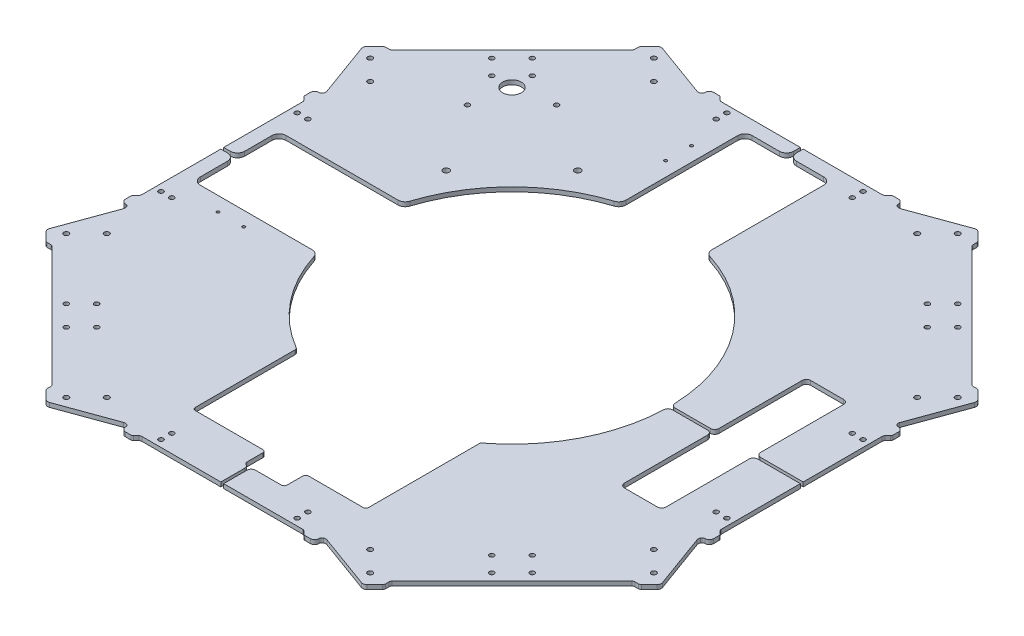
from build123d import *

# Parameters (mm, degrees)
SKETCH_1_R                 = 110
EXTRUDE_1_DEPTH            = 3
SKETCH_2_W                 = 110
SKETCH_2_H                 = 98
CUT_EXTRUDE_1_DEPTH        = 10
SKETCH_3_W                 = 11
SKETCH_3_H                 = 90
CUT_EXTRUDE_2_DEPTH        = 10
SKETCH_4_W                 = 28
SKETCH_4_H                 = 30
CUT_EXTRUDE_3_DEPTH        = 10
FILLET_1_R                 = 2
SKETCH_5_R                 = 2.65
SKETCH_5_R_2               = 1.65
CUT_EXTRUDE_4_DEPTH        = 10
SKETCH_6_W                 = 135
SKETCH_6_H                 = 32
SKETCH_6_W_2               = 32
SKETCH_6_H_2               = 135
CUT_EXTRUDE_5_DEPTH        = 313.909132177
SKETCH_7_W                 = 29
SKETCH_7_H                 = 130
CUT_EXTRUDE_6_DEPTH        = 10
EXTRUDE_2_DEPTH            = 3
SKETCH_12_R                = 1.65
CUT_EXTRUDE_7_DEPTH        = 112
CUT_EXTRUDE_1_2_DEPTH      = 304.514826656
CUT_EXTRUDE_1_2_DEPTH_BACK = 304.514826656
SKETCH_13_W                = 410.5
SKETCH_13_H                = 2
CUT_EXTRUDE_2_2_DEPTH      = 304.514826656
CUT_EXTRUDE_2_2_DEPTH_BACK = 304.514826656
SKETCH_14_W                = 2
SKETCH_14_H                = 410.5
FILLET_2_R                 = 3
FILLET_3_R                 = 3
FILLET_4_R                 = 3
FILLET_5_R                 = 3
FILLET_6_R                 = 3
SKETCH_15_R                = 1.75
CUT_EXTRUDE_8_DEPTH        = 10
SKETCH_16_R                = 1.65
SKETCH_16_R_2              = 2.15
CUT_EXTRUDE_9_DEPTH        = 10
SKETCH_17_R                = 6.5
CUT_EXTRUDE_10_DEPTH       = 303.846289435
SKETCH_18_R                = 1
SKETCH_18_W                = 60
SKETCH_18_H                = 90
CUT_EXTRUDE_11_DEPTH       = 303.846289435
SKETCH_20_R                = 1
SKETCH_20_W                = 90
SKETCH_20_H                = 60
CUT_EXTRUDE_13_DEPTH       = 303.846289435
FILLET_7_R                 = 5
FILLET_8_R                 = 5
FILLET_9_R                 = 5
CUT_EXTRUDE_15_DEPTH       = 10
FILLET_12_R                = 2
FILLET_13_R                = 2
FILLET_14_R                = 2
FILLET_15_R                = 2
CUT_EXTRUDE_17_DEPTH       = 10
FILLET_16_R                = 2
FILLET_17_R                = 2
FILLET_18_R                = 2
FILLET_19_R                = 2


# Some blends are built 0.0001 mm under size
with BuildPart() as part:
    # 草图1 → 凸台-拉伸1 (new body)
    with BuildSketch(Plane(origin=(0, 0, 0), x_dir=(1, 0, 0), z_dir=(0, 1, 0))):
        Polygon((221.25, -67.5), (221.25, 67.5), (201.200576851, 67.5), (67.5, 201.200576851), (67.5, 221.25), (-67.5, 221.25), (-67.5, 201.200576851), (-201.200576851, 67.5), (-221.25, 67.5), (-221.25, -67.5), (-201.200576851, -67.5), (-67.5, -201.200576851), (-67.5, -221.25), (67.5, -221.25), (67.5, -201.200576851), (201.200576851, -67.5), align=None)
        with Locations(Location((0, 0, 0), (0, 0, 270))):
            Circle(SKETCH_1_R, mode=Mode.SUBTRACT)
    extrude(amount=EXTRUDE_1_DEPTH)

    # 草图2 → Cut-Extrude 1 (cut)
    with BuildSketch(Plane(origin=(0, 3, 0), x_dir=(1, 0, 0), z_dir=(0, 1, 0))):
        with Locations((0, -119)):
            Rectangle(SKETCH_2_W, SKETCH_2_H)
    extrude(amount=-CUT_EXTRUDE_1_DEPTH, mode=Mode.SUBTRACT)

    # 草图3 → Cut-Extrude 2 (cut)
    with BuildSketch(Plane(origin=(0, 3, 0), x_dir=(1, 0, 0), z_dir=(0, 1, 0))):
        with Locations((60.5, -123)):
            Rectangle(SKETCH_3_W, SKETCH_3_H)
    extrude(amount=-CUT_EXTRUDE_2_DEPTH, mode=Mode.SUBTRACT)

    # 草图4 → 切除-拉伸3 (cut)
    with BuildSketch(Plane(origin=(0, 3, 0), x_dir=(1, 0, 0), z_dir=(0, 1, 0))):
        with Locations((10, -168)):
            Rectangle(SKETCH_4_W, SKETCH_4_H)
    extrude(amount=-CUT_EXTRUDE_3_DEPTH, mode=Mode.SUBTRACT)

    # 圆角1
    fillet_1_edges = [part.edges().sort_by_distance(p)[0] for p in [
        (-4, 1.5, 183),
        (221.25, 1.5, -67.5),
        (221.25, 1.5, 67.5),
        (201.200576851, 1.5, 67.5),
        (67.5, 1.5, 201.200576851),
        (67.5, 1.5, 221.25),
        (-67.5, 1.5, 221.25),
        (-67.5, 1.5, 201.200576851),
        (-201.200576851, 1.5, 67.5),
        (-221.25, 1.5, 67.5),
        (-221.25, 1.5, -67.5),
        (-201.200576851, 1.5, -67.5),
        (-67.5, 1.5, -201.200576851),
        (-67.5, 1.5, -221.25),
        (67.5, 1.5, -221.25),
        (67.5, 1.5, -201.200576851),
        (201.200576851, 1.5, -67.5),
        (-55, 1.5, 95.262794416),
        (-55, 1.5, 168),
        (66, 1.5, 88),
        (66, 1.5, 168),
        (-4, 1.5, 168),
        (24, 1.5, 168),
        (24, 1.5, 183),
    ]]
    fillet(fillet_1_edges, radius=FILLET_1_R)

    # 草图5 → 切除-拉伸4 (cut)
    with BuildSketch(Plane(origin=(0, 3, 0), x_dir=(1, 0, 0), z_dir=(0, 1, 0))):
        with Locations(Location((-208.25, 47.5, 0), (0, 0, 270))):
            Circle(SKETCH_5_R)
        with Locations(Location((-197.5, 47.5, 0), (0, 0, 270))):
            Circle(SKETCH_5_R_2)
        with Locations(Location((-190, 47.5, 0), (0, 0, 270))):
            Circle(SKETCH_5_R_2)
        with Locations(Location((-190, -47.5, 0), (0, 0, 270))):
            Circle(SKETCH_5_R_2)
        with Locations(Location((-197.5, -47.5, 0), (0, 0, 270))):
            Circle(SKETCH_5_R_2)
        with Locations(Location((-208.25, -47.5, 0), (0, 0, 270))):
            Circle(SKETCH_5_R)
        with Locations(Location((47.5, 190, 0), (0, 0, 270))):
            Circle(SKETCH_5_R_2)
        with Locations(Location((47.5, 197.5, 0), (0, 0, 270))):
            Circle(SKETCH_5_R_2)
        with Locations(Location((47.5, 208.25, 0), (0, 0, 270))):
            Circle(SKETCH_5_R)
        with Locations(Location((-47.5, 208.25, 0), (0, 0, 270))):
            Circle(SKETCH_5_R)
        with Locations(Location((-47.5, 197.5, 0), (0, 0, 270))):
            Circle(SKETCH_5_R_2)
        with Locations(Location((-47.5, 190, 0), (0, 0, 270))):
            Circle(SKETCH_5_R_2)
        with Locations(Location((190, -47.5, 0), (0, 0, 270))):
            Circle(SKETCH_5_R_2)
        with Locations(Location((197.5, -47.5, 0), (0, 0, 270))):
            Circle(SKETCH_5_R_2)
        with Locations(Location((208.25, -47.5, 0), (0, 0, 270))):
            Circle(SKETCH_5_R)
        with Locations(Location((208.25, 47.5, 0), (0, 0, 270))):
            Circle(SKETCH_5_R)
        with Locations(Location((197.5, 47.5, 0), (0, 0, 270))):
            Circle(SKETCH_5_R_2)
        with Locations(Location((190, 47.5, 0), (0, 0, 270))):
            Circle(SKETCH_5_R_2)
        with Locations(Location((-47.5, -190, 0), (0, 0, 270))):
            Circle(SKETCH_5_R_2)
        with Locations(Location((-47.5, -197.5, 0), (0, 0, 270))):
            Circle(SKETCH_5_R_2)
        with Locations(Location((-47.5, -208.25, 0), (0, 0, 270))):
            Circle(SKETCH_5_R)
        with Locations(Location((47.5, -208.25, 0), (0, 0, 270))):
            Circle(SKETCH_5_R)
        with Locations(Location((47.5, -197.5, 0), (0, 0, 270))):
            Circle(SKETCH_5_R_2)
        with Locations(Location((47.5, -190, 0), (0, 0, 270))):
            Circle(SKETCH_5_R_2)
    extrude(amount=-CUT_EXTRUDE_4_DEPTH, mode=Mode.SUBTRACT)

    # 草图6 → 切除-拉伸5 (cut, through all)
    with BuildSketch(Plane(origin=(0, 3, 0), x_dir=(1, 0, 0), z_dir=(0, 1, 0))):
        with Locations((0, -221.25)):
            Rectangle(SKETCH_6_W, SKETCH_6_H)
        with Locations((-221.25, 0)):
            Rectangle(SKETCH_6_W_2, SKETCH_6_H_2)
        with Locations((221.25, 0)):
            Rectangle(SKETCH_6_W_2, SKETCH_6_H_2)
        with Locations((0, 221.25)):
            Rectangle(SKETCH_6_W, SKETCH_6_H)
    extrude(amount=-CUT_EXTRUDE_5_DEPTH, mode=Mode.SUBTRACT)

    # 草图7 → 切除-拉伸6 (cut)
    with BuildSketch(Plane(origin=(0, 3, 0), x_dir=(1, 0, 0), z_dir=(0, 1, 0))):
        with Locations((155, 0)):
            Rectangle(SKETCH_7_W, SKETCH_7_H)
    extrude(amount=-CUT_EXTRUDE_6_DEPTH, mode=Mode.SUBTRACT)

    # 草图8 → 凸台-拉伸2 (add)
    with BuildSketch(Plane(origin=(0, 3, 0), x_dir=(1, 0, 0), z_dir=(0, 1, 0))):
        Polygon((110.662211256, -214.60690809), (214.60690809, -110.662211256), (199.511809131, -69.18876772), (69.18876772, -199.511809131), align=None)
        Polygon((214.60690809, 110.662211256), (199.511809131, 69.18876772), (69.18876772, 199.511809131), (110.662211256, 214.60690809), align=None)
        Polygon((-214.60690809, -110.662211256), (-199.511809131, -69.18876772), (-69.18876772, -199.511809131), (-110.662211256, -214.60690809), align=None)
        Polygon((-110.662211256, 214.60690809), (-214.60690809, 110.662211256), (-199.511809131, 69.18876772), (-69.18876772, 199.511809131), align=None)
    extrude(amount=-EXTRUDE_2_DEPTH)

    # 草图12 → 切除-拉伸7 (cut)
    with BuildSketch(Plane(origin=(0, 3, 0), x_dir=(1, 0, 0), z_dir=(0, 1, 0))):
        with Locations(Location((162.634559673, -148.492424049, 0), (0, 0, 270))):
            Circle(SKETCH_12_R)
        with Locations(Location((152.027957955, -137.885822331, 0), (0, 0, 270))):
            Circle(SKETCH_12_R)
        with Locations(Location((137.885822331, -152.027957955, 0), (0, 0, 270))):
            Circle(SKETCH_12_R)
        with Locations(Location((148.492424049, -162.634559673, 0), (0, 0, 270))):
            Circle(SKETCH_12_R)
        with Locations(Location((148.492424049, 162.634559673, 0), (0, 0, 270))):
            Circle(SKETCH_12_R)
        with Locations(Location((137.885822331, 152.027957955, 0), (0, 0, 270))):
            Circle(SKETCH_12_R)
        with Locations(Location((152.027957955, 137.885822331, 0), (0, 0, 270))):
            Circle(SKETCH_12_R)
        with Locations(Location((162.634559673, 148.492424049, 0), (0, 0, 270))):
            Circle(SKETCH_12_R)
        with Locations(Location((-148.492424049, -162.634559673, 0), (0, 0, 270))):
            Circle(SKETCH_12_R)
        with Locations(Location((-137.885822331, -152.027957955, 0), (0, 0, 270))):
            Circle(SKETCH_12_R)
        with Locations(Location((-152.027957955, -137.885822331, 0), (0, 0, 270))):
            Circle(SKETCH_12_R)
        with Locations(Location((-162.634559673, -148.492424049, 0), (0, 0, 270))):
            Circle(SKETCH_12_R)
        with Locations(Location((-162.634559673, 148.492424049, 0), (0, 0, 270))):
            Circle(SKETCH_12_R)
        with Locations(Location((-152.027957955, 137.885822331, 0), (0, 0, 270))):
            Circle(SKETCH_12_R)
        with Locations(Location((-137.885822331, 152.027957955, 0), (0, 0, 270))):
            Circle(SKETCH_12_R)
        with Locations(Location((-148.492424049, 162.634559673, 0), (0, 0, 270))):
            Circle(SKETCH_12_R)
    extrude(amount=-CUT_EXTRUDE_7_DEPTH, mode=Mode.SUBTRACT)

    # 草图13 → Cut-Extrude 1 2 (cut, two sides: drawn at the far end of the back side and taken through both)
    with BuildSketch(Plane(origin=(0, 3, 0), x_dir=(1, 0, 0), z_dir=(0, 1, 0)).offset(-CUT_EXTRUDE_1_2_DEPTH_BACK)):
        Rectangle(SKETCH_13_W, SKETCH_13_H)
    extrude(amount=CUT_EXTRUDE_1_2_DEPTH + CUT_EXTRUDE_1_2_DEPTH_BACK, mode=Mode.SUBTRACT)


with BuildPart() as cut_extrude_1_2_piece_1:
    # of the separate pieces the step leaves, piece 1, a body of its own (cut_extrude_1_2_pieces)
    add(part.part.solids().sort_by_distance((169.5, 0, -1))[0])


with BuildPart() as cut_extrude_1_2_piece_2:
    # of the separate pieces the step leaves, piece 2, a body of its own (cut_extrude_1_2_pieces)
    add(part.part.solids().sort_by_distance((202.029003976, 0, 67.5))[0])


with BuildPart() as cut_extrude_2_2_tool:
    # 草图14 → Cut-Extrude 2 2 (new, two sides: drawn at the far end of the back side and taken through both)
    with BuildSketch(Plane(origin=(0, 3, 0), x_dir=(1, 0, 0), z_dir=(0, 1, 0)).offset(-CUT_EXTRUDE_2_2_DEPTH_BACK)):
        Rectangle(SKETCH_14_W, SKETCH_14_H)
    extrude(amount=CUT_EXTRUDE_2_2_DEPTH + CUT_EXTRUDE_2_2_DEPTH_BACK)


with BuildPart() as cut_extrude_1_2_piece_1_1:
    add(cut_extrude_1_2_piece_1.part)

    # Cut-Extrude 2 2: cut by cut_extrude_2_2_tool
    add(cut_extrude_2_2_tool.part, mode=Mode.SUBTRACT)


with BuildPart() as cut_extrude_1_2_piece_2_1:
    add(cut_extrude_1_2_piece_2.part)

    # Cut-Extrude 2 2: cut by cut_extrude_2_2_tool
    add(cut_extrude_2_2_tool.part, mode=Mode.SUBTRACT)


with BuildPart() as cut_extrude_2_2_piece_1:
    # of the separate pieces the step leaves, piece 1, a body of its own (cut_extrude_2_2_pieces)
    add(cut_extrude_1_2_piece_1_1.part.solids().sort_by_distance((-1, 0, -109.995454452))[0])

    # 圆角5
    # the kernel refuses this fillet: 3 mm, written as the material it adds along each edge
    with BuildSketch(Plane(origin=(-69.18876772, 3, -199.511809131), x_dir=(-0.9396926207859093, 0, -0.3420201433256662), z_dir=(0, -1, 0))) as fillet_5_piece_1:
        with BuildLine():
            CenterArc((1.887083369, 3), FILLET_5_R, 211.922044532, 58.077955468)
            Line((-0.659221556, 1.413705188), (0, 0))
            Line((0, 0), (1.887083369, 0))
        make_face()
    extrude(amount=3)
    with BuildSketch(Plane(origin=(-199.511809131, 3, -69.18876772), x_dir=(-0.7071067811865065, 0, 0.7071067811865885), z_dir=(0, -1, 0))) as fillet_5_piece_2:
        with BuildLine():
            CenterArc((1.921407468, 2.978133138), FILLET_5_R, 205, 58.077955468)
            Line((-0.797515893, 1.710278352), (0, 0))
            Line((0, 0), (1.559851089, 0))
        make_face()
    extrude(amount=3)
    # the kernel refuses this fillet: 3 mm, written as the material it takes off along each edge
    with BuildSketch(Plane(origin=(-67.5, 10.5, -205.25), x_dir=(0, 0, 1), z_dir=(0, -1, 0)), Plane(origin=(-205.25, 10.5, -67.5), x_dir=(0, 0, 1), z_dir=(0, -1, 0)), Plane(origin=(-205.25, 10.5, -1), x_dir=(1, 0, 0), z_dir=(0, -1, 0)), Plane(origin=(-1, 10.5, -205.25), x_dir=(-1, 0, 0), z_dir=(0, -1, 0))) as fillet_5_2_piece_1:
        with BuildLine():
            CenterArc((FILLET_5_R, -FILLET_5_R), FILLET_5_R, 90, 90)
            Line((0, -FILLET_5_R), (0, 0))
            Line((0, 0), (FILLET_5_R, 0))
        make_face()
    extrude(amount=18, mode=Mode.SUBTRACT)
    with BuildSketch(Plane(origin=(-110.662211256, 7.778026956, -214.60690809), x_dir=(-0.7071067811865476, 0, 0.7071067811865476), z_dir=(0, -1, 0)), Plane(origin=(-214.60690809, 7.778026956, -110.662211256), x_dir=(0.34202014332566893, 0, 0.9396926207859083), z_dir=(0, -1, 0))) as fillet_5_2_piece_2:
        with BuildLine():
            CenterArc((FILLET_5_R * 0.637070260807, -FILLET_5_R), FILLET_5_R, 90, 65)
            Line((-FILLET_5_R * 0.269237526229, -FILLET_5_R * 0.577381738259), (0, 0))
            Line((0, 0), (FILLET_5_R * 0.637070260807, 0))
        make_face()
    extrude(amount=12.556053912, mode=Mode.SUBTRACT)
    with BuildSketch(Plane(origin=(-109.995454452, 10.334317242, -1), x_dir=(0.022246495156751204, 0, -0.9997525161024806), z_dir=(0, -1, 0))) as fillet_5_2_piece_3:
        with BuildLine():
            CenterArc((2.933992407, -2.999740332), FILLET_5_R, 90.753857544, 87.971407014)
            Line((-0.065265141, -2.933000847), (0, 0))
            ThreePointArc((0, 0), (1.447260829, -0.009521157), (2.894521657, 0))
        make_face()
    extrude(amount=17.668634484, mode=Mode.SUBTRACT)
    with BuildSketch(Plane(origin=(-1, 10.334317242, -109.995454452), x_dir=(-0.9997525161024806, 0, 0.02224649515675109), z_dir=(0, -1, 0))) as fillet_5_2_piece_4:
        with BuildLine():
            CenterArc((2.933992407, 2.999740332), FILLET_5_R, 181.274735442, 87.971407014)
            Line((-0.065265141, 2.933000847), (0, 0))
            ThreePointArc((0, 0), (1.447260829, 0.009521157), (2.894521657, 0))
        make_face()
    extrude(amount=17.668634484, mode=Mode.SUBTRACT)


with BuildPart() as cut_extrude_2_2_piece_2:
    # of the separate pieces the step leaves, piece 2, a body of its own (cut_extrude_2_2_pieces)
    add(cut_extrude_1_2_piece_1_1.part.solids().sort_by_distance((169.5, 0, -65))[0])

    # 圆角4
    # the kernel refuses this fillet: 3 mm, written as the material it adds along each edge
    with BuildSketch(Plane(origin=(69.18876772, 3, -199.511809131), x_dir=(-0.7071067811865521, 0, -0.7071067811865429), z_dir=(0, -1, 0))) as fillet_4_piece_1:
        with BuildLine():
            CenterArc((1.921407468, 2.978133138), FILLET_4_R, 205, 58.077955468)
            Line((-0.797515893, 1.710278352), (0, 0))
            Line((0, 0), (1.559851089, 0))
        make_face()
    extrude(amount=3)
    with BuildSketch(Plane(origin=(169.5, 3, -65), x_dir=(0, 0, 1), z_dir=(0, -1, 0)), Plane(origin=(140.5, 3, -65), x_dir=(1, 0, 0), z_dir=(0, -1, 0))) as fillet_4_piece_2:
        with BuildLine():
            CenterArc((FILLET_4_R, FILLET_4_R), FILLET_4_R, 180, 90)
            Line((0, FILLET_4_R), (0, 0))
            Line((0, 0), (FILLET_4_R, 0))
        make_face()
    extrude(amount=3)
    # the kernel refuses this fillet: 3 mm, written as the material it takes off along each edge
    with BuildSketch(Plane(origin=(1, 10.334317242, -109.995454452), x_dir=(0.9997525161024806, 0, 0.022246495156751034), z_dir=(0, -1, 0))) as fillet_4_2_piece_1:
        with BuildLine():
            CenterArc((2.933992407, -2.999740332), FILLET_4_R, 90.753857544, 87.971407014)
            Line((-0.065265141, -2.933000847), (0, 0))
            ThreePointArc((0, 0), (1.447260829, -0.009521157), (2.894521657, 0))
        make_face()
    extrude(amount=17.668634484, mode=Mode.SUBTRACT)
    with BuildSketch(Plane(origin=(1, 10.5, -205.25), x_dir=(0, 0, 1), z_dir=(0, -1, 0)), Plane(origin=(67.5, 10.5, -205.25), x_dir=(-1, 0, 0), z_dir=(0, -1, 0)), Plane(origin=(205.25, 10.5, -67.5), x_dir=(-1, 0, 0), z_dir=(0, -1, 0)), Plane(origin=(140.5, 10.5, -1), x_dir=(0, 0, -1), z_dir=(0, -1, 0)), Plane(origin=(169.5, -7.5, -1), x_dir=(0, 0, -1), z_dir=(0, 1, 0))) as fillet_4_2_piece_2:
        with BuildLine():
            CenterArc((FILLET_4_R, -FILLET_4_R), FILLET_4_R, 90, 90)
            Line((0, -FILLET_4_R), (0, 0))
            Line((0, 0), (FILLET_4_R, 0))
        make_face()
    extrude(amount=18, mode=Mode.SUBTRACT)
    with BuildSketch(Plane(origin=(110.662211256, 7.778026956, -214.60690809), x_dir=(-0.9396926207859083, 0, 0.34202014332566893), z_dir=(0, -1, 0)), Plane(origin=(214.60690809, 7.778026956, -110.662211256), x_dir=(-0.7071067811865476, 0, -0.7071067811865476), z_dir=(0, -1, 0))) as fillet_4_2_piece_3:
        with BuildLine():
            CenterArc((FILLET_4_R * 0.637070260807, -FILLET_4_R), FILLET_4_R, 90, 65)
            Line((-FILLET_4_R * 0.269237526229, -FILLET_4_R * 0.577381738259), (0, 0))
            Line((0, 0), (FILLET_4_R * 0.637070260808, 0))
        make_face()
    extrude(amount=12.556053912, mode=Mode.SUBTRACT)
    with BuildSketch(Plane(origin=(109.995454452, 10.334317242, -1), x_dir=(1, 0, 0), z_dir=(0, -1, 0))) as fillet_4_2_piece_4:
        with BuildLine():
            CenterArc((2.933726897, -3), FILLET_4_R, 90, 87.971407014)
            ThreePointArc((-0.064392962, -2.89380531), (-0.02267768, -1.447114467), (0, 0))
            Line((0, 0), (2.933726897, 0))
        make_face()
    extrude(amount=17.668634484, mode=Mode.SUBTRACT)
    with BuildSketch(Plane(origin=(205.25, -7.5, -1), x_dir=(0, 0, -1), z_dir=(0, 1, 0))) as fillet_4_2_piece_5:
        with BuildLine():
            CenterArc((FILLET_4_R, FILLET_4_R), FILLET_4_R, 180, 90)
            Line((0, FILLET_4_R), (0, 0))
            Line((0, 0), (FILLET_4_R, 0))
        make_face()
    extrude(amount=18, mode=Mode.SUBTRACT)


with BuildPart() as cut_extrude_2_2_piece_1_of_cut_extrude_1:
    # of the separate pieces the step leaves, piece 1, a body of its own (cut_extrude_2_2_pieces_of_cut_extrude_1)
    add(cut_extrude_1_2_piece_2_1.part.solids().sort_by_distance((-1, 0, 205.25))[0])

    # 圆角2
    # the kernel refuses this fillet: 3 mm, written as the material it adds along each edge
    with BuildSketch(Plane(origin=(-69.18876772, 3, 199.511809131), x_dir=(0.7071067811865567, 0, 0.7071067811865385), z_dir=(0, -1, 0))) as fillet_2_piece_1:
        with BuildLine():
            CenterArc((1.921407468, 2.978133138), FILLET_2_R, 205, 58.077955468)
            Line((-0.797515893, 1.710278352), (0, 0))
            Line((0, 0), (1.559851089, 0))
        make_face()
    extrude(amount=3)
    with BuildSketch(Plane(origin=(-199.511809131, 3, 69.18876772), x_dir=(-0.34202014332567227, 0, 0.9396926207859071), z_dir=(0, -1, 0))) as fillet_2_piece_2:
        with BuildLine():
            CenterArc((1.887083369, 3), FILLET_2_R, 211.922044532, 58.077955468)
            Line((-0.659221556, 1.413705188), (0, 0))
            Line((0, 0), (1.887083369, 0))
        make_face()
    extrude(amount=3)
    # the kernel refuses this fillet: 3 mm, written as the material it takes off along each edge
    with BuildSketch(Plane(origin=(-1, -7.5, 205.25), x_dir=(-1, 0, 0), z_dir=(0, 1, 0)), Plane(origin=(-67.5, 10.5, 205.25), x_dir=(1, 0, 0), z_dir=(0, -1, 0)), Plane(origin=(-205.25, 10.5, 1), x_dir=(0, 0, 1), z_dir=(0, -1, 0)), Plane(origin=(-205.25, 10.5, 67.5), x_dir=(1, 0, 0), z_dir=(0, -1, 0))) as fillet_2_2_piece_1:
        with BuildLine():
            CenterArc((FILLET_2_R, -FILLET_2_R), FILLET_2_R, 90, 90)
            Line((0, -FILLET_2_R), (0, 0))
            Line((0, 0), (FILLET_2_R, 0))
        make_face()
    extrude(amount=18, mode=Mode.SUBTRACT)
    with BuildSketch(Plane(origin=(-214.60690809, 7.778026956, 110.662211256), x_dir=(0.7071067811865476, 0, 0.7071067811865476), z_dir=(0, -1, 0)), Plane(origin=(-110.662211256, 7.778026956, 214.60690809), x_dir=(0.9396926207859083, 0, -0.34202014332566893), z_dir=(0, -1, 0))) as fillet_2_2_piece_2:
        with BuildLine():
            CenterArc((FILLET_2_R * 0.637070260807, -FILLET_2_R), FILLET_2_R, 90, 65)
            Line((-FILLET_2_R * 0.269237526229, -FILLET_2_R * 0.577381738259), (0, 0))
            Line((0, 0), (FILLET_2_R * 0.637070260807, 0))
        make_face()
    extrude(amount=12.556053912, mode=Mode.SUBTRACT)

    # 圆角6
    fillet_6_edges = [cut_extrude_2_2_piece_1_of_cut_extrude_1.edges().sort_by_distance(p)[0] for p in [
        (-1, 1.5, 183),
        (-109.995454452, 1.5, 1),
    ]]
    fillet(fillet_6_edges, radius=FILLET_6_R)


with BuildPart() as cut_extrude_2_2_piece_2_of_cut_extrude_1:
    # of the separate pieces the step leaves, piece 2, a body of its own (cut_extrude_2_2_pieces_of_cut_extrude_1)
    add(cut_extrude_1_2_piece_2_1.part.solids().sort_by_distance((202.029003976, 0, 67.5))[0])

    # 圆角3
    # the kernel refuses this fillet: 3 mm, written as the material it adds along each edge
    with BuildSketch(Plane(origin=(169.5, 3, 65), x_dir=(-1, 0, 0), z_dir=(0, -1, 0)), Plane(origin=(140.5, 3, 65), x_dir=(0, 0, -1), z_dir=(0, -1, 0))) as fillet_3_piece_1:
        with BuildLine():
            CenterArc((FILLET_3_R, FILLET_3_R), FILLET_3_R, 180, 90)
            Line((0, FILLET_3_R), (0, 0))
            Line((0, 0), (FILLET_3_R, 0))
        make_face()
    extrude(amount=3)
    with BuildSketch(Plane(origin=(199.511809131, 3, 69.18876772), x_dir=(0.7071067811865385, 0, -0.7071067811865567), z_dir=(0, -1, 0))) as fillet_3_piece_2:
        with BuildLine():
            CenterArc((1.921407468, 2.978133138), FILLET_3_R, 205, 58.077955468)
            Line((-0.797515893, 1.710278352), (0, 0))
            Line((0, 0), (1.559851089, 0))
        make_face()
    extrude(amount=3)
    with BuildSketch(Plane(origin=(69.18876772, 3, 199.511809131), x_dir=(0.9396926207859093, 0, 0.3420201433256662), z_dir=(0, -1, 0))) as fillet_3_piece_3:
        with BuildLine():
            CenterArc((1.887083369, 3), FILLET_3_R, 211.922044532, 58.077955468)
            Line((-0.659221556, 1.413705188), (0, 0))
            Line((0, 0), (1.887083369, 0))
        make_face()
    extrude(amount=3)
    # the kernel refuses this fillet: 3 mm, written as the material it takes off along each edge
    with BuildSketch(Plane(origin=(109.995454452, 10.334317242, 1), x_dir=(-0.02224649515675097, 0, 0.9997525161024806), z_dir=(0, -1, 0))) as fillet_3_2_piece_1:
        with BuildLine():
            CenterArc((2.933992407, -2.999740332), FILLET_3_R, 90.753857544, 87.971407014)
            Line((-0.065265141, -2.933000847), (0, 0))
            ThreePointArc((0, 0), (1.447260829, -0.009521157), (2.894521657, 0))
        make_face()
    extrude(amount=17.668634484, mode=Mode.SUBTRACT)
    with BuildSketch(Plane(origin=(140.5, -7.5, 1), x_dir=(-1, 0, 0), z_dir=(0, 1, 0)), Plane(origin=(205.25, -7.5, 1), x_dir=(-1, 0, 0), z_dir=(0, 1, 0)), Plane(origin=(1, -7.5, 183), x_dir=(0, 0, 1), z_dir=(0, 1, 0)), Plane(origin=(1, -7.5, 205.25), x_dir=(1, 0, 0), z_dir=(0, 1, 0))) as fillet_3_2_piece_2:
        with BuildLine():
            CenterArc((FILLET_3_R, FILLET_3_R), FILLET_3_R, 180, 90)
            Line((0, FILLET_3_R), (0, 0))
            Line((0, 0), (FILLET_3_R, 0))
        make_face()
    extrude(amount=18, mode=Mode.SUBTRACT)
    with BuildSketch(Plane(origin=(169.5, 10.5, 1), x_dir=(0, 0, 1), z_dir=(0, -1, 0)), Plane(origin=(205.25, 10.5, 67.5), x_dir=(0, 0, -1), z_dir=(0, -1, 0)), Plane(origin=(67.5, 10.5, 205.25), x_dir=(0, 0, -1), z_dir=(0, -1, 0))) as fillet_3_2_piece_3:
        with BuildLine():
            CenterArc((FILLET_3_R, -FILLET_3_R), FILLET_3_R, 90, 90)
            Line((0, -FILLET_3_R), (0, 0))
            Line((0, 0), (FILLET_3_R, 0))
        make_face()
    extrude(amount=18, mode=Mode.SUBTRACT)
    with BuildSketch(Plane(origin=(214.60690809, 7.778026956, 110.662211256), x_dir=(-0.34202014332566893, 0, -0.9396926207859083), z_dir=(0, -1, 0)), Plane(origin=(110.662211256, 7.778026956, 214.60690809), x_dir=(0.7071067811865476, 0, -0.7071067811865476), z_dir=(0, -1, 0))) as fillet_3_2_piece_4:
        with BuildLine():
            CenterArc((FILLET_3_R * 0.637070260807, -FILLET_3_R), FILLET_3_R, 90, 65)
            Line((-FILLET_3_R * 0.269237526229, -FILLET_3_R * 0.577381738259), (0, 0))
            Line((0, 0), (FILLET_3_R * 0.637070260808, 0))
        make_face()
    extrude(amount=12.556053912, mode=Mode.SUBTRACT)


with BuildPart() as cut_extrude_8_tool:
    # 草图15 → 切除-拉伸8 (new body)
    with BuildSketch(Plane.XZ):
        with Locations(Location((106.066017178, -205.060966544, 0), (0, 0, 270))):
            Circle(SKETCH_15_R)
        with Locations(Location((91.923881554, -190.91883092, 0), (0, 0, 270))):
            Circle(SKETCH_15_R)
        with Locations(Location((190.91883092, -91.923881554, 0), (0, 0, 90))):
            Circle(SKETCH_15_R)
        with Locations(Location((205.060966544, -106.066017178, 0), (0, 0, 90))):
            Circle(SKETCH_15_R)
        with Locations(Location((-205.060966544, -106.066017178, 0), (0, 0, 270))):
            Circle(SKETCH_15_R)
        with Locations(Location((-190.91883092, -91.923881554, 0), (0, 0, 270))):
            Circle(SKETCH_15_R)
        with Locations(Location((-91.923881554, -190.91883092, 0), (0, 0, 90))):
            Circle(SKETCH_15_R)
        with Locations(Location((-106.066017178, -205.060966544, 0), (0, 0, 90))):
            Circle(SKETCH_15_R)
        with Locations(Location((-106.066017178, 205.060966544, 0), (0, 0, 270))):
            Circle(SKETCH_15_R)
        with Locations(Location((-91.923881554, 190.91883092, 0), (0, 0, 270))):
            Circle(SKETCH_15_R)
        with Locations(Location((-190.91883092, 91.923881554, 0), (0, 0, 90))):
            Circle(SKETCH_15_R)
        with Locations(Location((-205.060966544, 106.066017178, 0), (0, 0, 90))):
            Circle(SKETCH_15_R)
        with Locations(Location((205.060966544, 106.066017178, 0), (0, 0, 270))):
            Circle(SKETCH_15_R)
        with Locations(Location((190.91883092, 91.923881554, 0), (0, 0, 270))):
            Circle(SKETCH_15_R)
        with Locations(Location((91.923881554, 190.91883092, 0), (0, 0, 90))):
            Circle(SKETCH_15_R)
        with Locations(Location((106.066017178, 205.060966544, 0), (0, 0, 90))):
            Circle(SKETCH_15_R)
    extrude(amount=-CUT_EXTRUDE_8_DEPTH)


with BuildPart() as cut_extrude_2_2_piece_1_1:
    add(cut_extrude_2_2_piece_1.part)

    # 切除-拉伸8: cut by cut_extrude_8_tool
    add(cut_extrude_8_tool.part, mode=Mode.SUBTRACT)

    # 草图16 → 切除-拉伸9 (cut)
    with BuildSketch(Plane(origin=(0, 3, 0), x_dir=(1, 0, 0), z_dir=(0, 1, 0))):
        with Locations(Location((-111.722871427, 142.8355698, 0), (0, 0, 270))):
            Circle(SKETCH_16_R)
        with Locations(Location((-64.700270479, 110.662211256, 0), (0, 0, 270))):
            Circle(SKETCH_16_R_2)
        with Locations(Location((-110.662211256, 64.700270479, 0), (0, 0, 270))):
            Circle(SKETCH_16_R_2)
        with Locations(Location((-142.8355698, 111.722871427, 0), (0, 0, 270))):
            Circle(SKETCH_16_R)
    extrude(amount=-CUT_EXTRUDE_9_DEPTH, mode=Mode.SUBTRACT)

    # 草图17 → 切除-拉伸10 (cut, through all)
    with BuildSketch(Plane.XZ):
        with Locations(Location((-137.885822331, -137.885822331, 0), (0, 0, 270))):
            Circle(SKETCH_17_R)
    extrude(amount=-CUT_EXTRUDE_10_DEPTH, mode=Mode.SUBTRACT)


with BuildPart() as cut_extrude_2_2_piece_2_1:
    add(cut_extrude_2_2_piece_2.part)

    # 切除-拉伸8: cut by cut_extrude_8_tool
    add(cut_extrude_8_tool.part, mode=Mode.SUBTRACT)


with BuildPart() as cut_extrude_2_2_piece_1_of_cut_extrude_1_1:
    add(cut_extrude_2_2_piece_1_of_cut_extrude_1.part)

    # 切除-拉伸8: cut by cut_extrude_8_tool
    add(cut_extrude_8_tool.part, mode=Mode.SUBTRACT)


with BuildPart() as cut_extrude_2_2_piece_2_of_cut_extrude_1_1:
    add(cut_extrude_2_2_piece_2_of_cut_extrude_1.part)

    # 切除-拉伸8: cut by cut_extrude_8_tool
    add(cut_extrude_8_tool.part, mode=Mode.SUBTRACT)


with BuildPart() as cut_extrude_11_tool:
    # 草图18 → 切除-拉伸11 (new, through all)
    with BuildSketch(Plane.XZ):
        with Locations(Location((-40, -147.25, 0), (0, 0, 270))):
            Circle(SKETCH_18_R)
        with Locations(Location((-40, -165.25, 0), (0, 0, 270))):
            Circle(SKETCH_18_R)
        with Locations((0, -147.589590674)):
            Rectangle(SKETCH_18_W, SKETCH_18_H)
    extrude(amount=-CUT_EXTRUDE_11_DEPTH)


with BuildPart() as cut_extrude_2_2_piece_1_2:
    add(cut_extrude_2_2_piece_1_1.part)

    # 切除-拉伸11: cut by cut_extrude_11_tool
    add(cut_extrude_11_tool.part, mode=Mode.SUBTRACT)


with BuildPart() as cut_extrude_2_2_piece_2_2:
    add(cut_extrude_2_2_piece_2_1.part)

    # 切除-拉伸11: cut by cut_extrude_11_tool
    add(cut_extrude_11_tool.part, mode=Mode.SUBTRACT)

    # 圆角9
    fillet_9_edges = [cut_extrude_2_2_piece_2_2.edges().sort_by_distance(p)[0] for p in [
        (1, 1.5, -192.589590674),
        (30, 1.5, -105.830052443),
        (30, 1.5, -192.589590674),
    ]]
    fillet(fillet_9_edges, radius=FILLET_9_R)


with BuildPart() as cut_extrude_13_tool:
    # 草图20 → 切除-拉伸13 (new, through all)
    with BuildSketch(Plane.XZ):
        with Locations(Location((-147.25, 40, 0), (0, 0, 270))):
            Circle(SKETCH_20_R)
        with Locations(Location((-165.25, 40, 0), (0, 0, 270))):
            Circle(SKETCH_20_R)
        with Locations((-147.589590674, 0)):
            Rectangle(SKETCH_20_W, SKETCH_20_H)
    extrude(amount=-CUT_EXTRUDE_13_DEPTH)


with BuildPart() as cut_extrude_2_2_piece_1_3:
    add(cut_extrude_2_2_piece_1_2.part)

    # 切除-拉伸13: cut by cut_extrude_13_tool
    add(cut_extrude_13_tool.part, mode=Mode.SUBTRACT)

    # 圆角8
    fillet_8_edges = [cut_extrude_2_2_piece_1_3.edges().sort_by_distance(p)[0] for p in [
        (-1, 1.5, -192.589590674),
        (-30, 1.5, -105.830052443),
        (-30, 1.5, -192.589590674),
        (-192.589590674, 1.5, -1),
        (-105.830052443, 1.5, -30),
        (-192.589590674, 1.5, -30),
    ]]
    fillet(fillet_8_edges, radius=FILLET_8_R)


with BuildPart() as cut_extrude_2_2_piece_1_of_cut_extrude_1_2:
    add(cut_extrude_2_2_piece_1_of_cut_extrude_1_1.part)

    # 切除-拉伸13: cut by cut_extrude_13_tool
    add(cut_extrude_13_tool.part, mode=Mode.SUBTRACT)

    # 圆角7
    fillet_7_edges = [cut_extrude_2_2_piece_1_of_cut_extrude_1_2.edges().sort_by_distance(p)[0] for p in [
        (-192.589590674, 1.5, 1),
        (-105.830052443, 1.5, 30),
        (-192.589590674, 1.5, 30),
    ]]
    fillet(fillet_7_edges, radius=FILLET_7_R)


with BuildPart() as cut_extrude_15_tool:
    # 草图21 → 切除-拉伸15 (new body)
    with BuildSketch(Plane(origin=(0, 3, 0), x_dir=(1, 0, 0), z_dir=(0, 1, 0))):
        Polygon((118.086832458, -207.182286888), (207.182286888, -118.086832458), (202.939646201, -118.086832458), (118.086832458, -202.939646201), align=None)
        Polygon((-207.182286888, -118.086832458), (-118.086832458, -207.182286888), (-118.086832458, -202.939646201), (-202.939646201, -118.086832458), align=None)
        Polygon((118.086832458, 207.182286888), (207.182286888, 118.086832458), (202.939646201, 118.086832458), (118.086832458, 202.939646201), align=None)
        Polygon((-118.086832458, 202.939646201), (-118.086832458, 207.182286888), (-207.182286888, 118.086832458), (-202.939646201, 118.086832458), align=None)
    extrude(amount=-CUT_EXTRUDE_15_DEPTH)


with BuildPart() as cut_extrude_2_2_piece_1_4:
    add(cut_extrude_2_2_piece_1_3.part)

    # 切除-拉伸15: cut by cut_extrude_15_tool
    add(cut_extrude_15_tool.part, mode=Mode.SUBTRACT)

    # 圆角12
    fillet_12_edges = [cut_extrude_2_2_piece_1_4.edges().sort_by_distance(p)[0] for p in [
        (-207.182286888, 1.5, -118.086832458),
        (-202.939646201, 1.5, -118.086832458),
        (-118.086832458, 1.5, -202.939646201),
        (-118.086832458, 1.5, -207.182286888),
    ]]
    fillet(fillet_12_edges, radius=FILLET_12_R)


with BuildPart() as cut_extrude_2_2_piece_2_3:
    add(cut_extrude_2_2_piece_2_2.part)

    # 切除-拉伸15: cut by cut_extrude_15_tool
    add(cut_extrude_15_tool.part, mode=Mode.SUBTRACT)

    # 圆角15
    fillet_15_edges = [cut_extrude_2_2_piece_2_3.edges().sort_by_distance(p)[0] for p in [
        (118.086832458, 1.5, -207.182286888),
        (207.182286888, 1.5, -118.086832458),
        (202.939646201, 1.5, -118.086832458),
        (118.086832458, 1.5, -202.939646201),
    ]]
    fillet(fillet_15_edges, radius=FILLET_15_R)


with BuildPart() as cut_extrude_2_2_piece_1_of_cut_extrude_1_3:
    add(cut_extrude_2_2_piece_1_of_cut_extrude_1_2.part)

    # 切除-拉伸15: cut by cut_extrude_15_tool
    add(cut_extrude_15_tool.part, mode=Mode.SUBTRACT)

    # 圆角13
    fillet_13_edges = [cut_extrude_2_2_piece_1_of_cut_extrude_1_3.edges().sort_by_distance(p)[0] for p in [
        (-118.086832458, 1.5, 207.182286888),
        (-207.182286888, 1.5, 118.086832458),
        (-202.939646201, 1.5, 118.086832458),
        (-118.086832458, 1.5, 202.939646201),
    ]]
    fillet(fillet_13_edges, radius=FILLET_13_R)


with BuildPart() as cut_extrude_2_2_piece_2_of_cut_extrude_1_2:
    add(cut_extrude_2_2_piece_2_of_cut_extrude_1_1.part)

    # 切除-拉伸15: cut by cut_extrude_15_tool
    add(cut_extrude_15_tool.part, mode=Mode.SUBTRACT)

    # 圆角14
    fillet_14_edges = [cut_extrude_2_2_piece_2_of_cut_extrude_1_2.edges().sort_by_distance(p)[0] for p in [
        (207.182286888, 1.5, 118.086832458),
        (118.086832458, 1.5, 207.182286888),
        (118.086832458, 1.5, 202.939646201),
        (202.939646201, 1.5, 118.086832458),
    ]]
    fillet(fillet_14_edges, radius=FILLET_14_R)


with BuildPart() as cut_extrude_17_tool:
    # 草图23 → 切除-拉伸17 (new body)
    with BuildSketch(Plane(origin=(0, 3, 0), x_dir=(1, 0, 0), z_dir=(0, 1, 0))):
        Polygon((-60, -205.25), (-57, -202.25), (57, -202.25), (60, -205.25), align=None)
        Polygon((205.25, -60), (202.25, -57), (202.25, 57), (205.25, 60), align=None)
        Polygon((60, 205.25), (57, 202.25), (-57, 202.25), (-60, 205.25), align=None)
        Polygon((-205.25, 60), (-202.25, 57), (-202.25, -57), (-205.25, -60), align=None)
    extrude(amount=-CUT_EXTRUDE_17_DEPTH)


with BuildPart() as cut_extrude_2_2_piece_1_5:
    add(cut_extrude_2_2_piece_1_4.part)

    # 切除-拉伸17: cut by cut_extrude_17_tool
    add(cut_extrude_17_tool.part, mode=Mode.SUBTRACT)

    # 圆角17
    fillet_17_edges = [cut_extrude_2_2_piece_1_5.edges().sort_by_distance(p)[0] for p in [
        (-68.085786438, 1.5, -200.614790413),
        (-60, 1.5, -205.25),
        (-57, 1.5, -202.25),
        (-200.614790413, 1.5, -68.085786438),
        (-205.25, 1.5, -60),
        (-202.25, 1.5, -57),
    ]]
    fillet(fillet_17_edges, radius=FILLET_17_R - 0.0001)  # a hair under: the kernel refuses the full size


with BuildPart() as cut_extrude_2_2_piece_2_4:
    add(cut_extrude_2_2_piece_2_3.part)

    # 切除-拉伸17: cut by cut_extrude_17_tool
    add(cut_extrude_17_tool.part, mode=Mode.SUBTRACT)

    # 圆角18
    fillet_18_edges = [cut_extrude_2_2_piece_2_4.edges().sort_by_distance(p)[0] for p in [
        (68.085786438, 1.5, -200.614790413),
        (60, 1.5, -205.25),
        (57, 1.5, -202.25),
        (199.511809131, 1.5, -69.18876772),
        (205.25, 1.5, -60),
        (202.25, 1.5, -57),
    ]]
    fillet(fillet_18_edges, radius=FILLET_18_R - 0.0001)  # a hair under: the kernel refuses the full size


with BuildPart() as cut_extrude_2_2_piece_1_of_cut_extrude_1_4:
    add(cut_extrude_2_2_piece_1_of_cut_extrude_1_3.part)

    # 切除-拉伸17: cut by cut_extrude_17_tool
    add(cut_extrude_17_tool.part, mode=Mode.SUBTRACT)

    # 圆角16
    fillet_16_edges = [cut_extrude_2_2_piece_1_of_cut_extrude_1_4.edges().sort_by_distance(p)[0] for p in [
        (-205.25, 1.5, 60),
        (-202.25, 1.5, 57),
        (-200.614790413, 1.5, 68.085786438),
        (-68.085786438, 1.5, 200.614790413),
        (-60, 1.5, 205.25),
        (-57, 1.5, 202.25),
    ]]
    fillet(fillet_16_edges, radius=FILLET_16_R - 0.0001)  # a hair under: the kernel refuses the full size


with BuildPart() as cut_extrude_2_2_piece_2_of_cut_extrude_1_3:
    add(cut_extrude_2_2_piece_2_of_cut_extrude_1_2.part)

    # 切除-拉伸17: cut by cut_extrude_17_tool
    add(cut_extrude_17_tool.part, mode=Mode.SUBTRACT)

    # 圆角19
    fillet_19_edges = [cut_extrude_2_2_piece_2_of_cut_extrude_1_3.edges().sort_by_distance(p)[0] for p in [
        (68.085786438, 1.5, 200.614790413),
        (57, 1.5, 202.25),
        (60, 1.5, 205.25),
        (200.614790413, 1.5, 68.085786438),
        (205.25, 1.5, 60),
        (202.25, 1.5, 57),
    ]]
    fillet(fillet_19_edges, radius=FILLET_19_R - 0.0001)  # a hair under: the kernel refuses the full size


solid = Compound([cut_extrude_2_2_piece_1_5.part, cut_extrude_2_2_piece_2_4.part, cut_extrude_2_2_piece_1_of_cut_extrude_1_4.part, cut_extrude_2_2_piece_2_of_cut_extrude_1_3.part])
